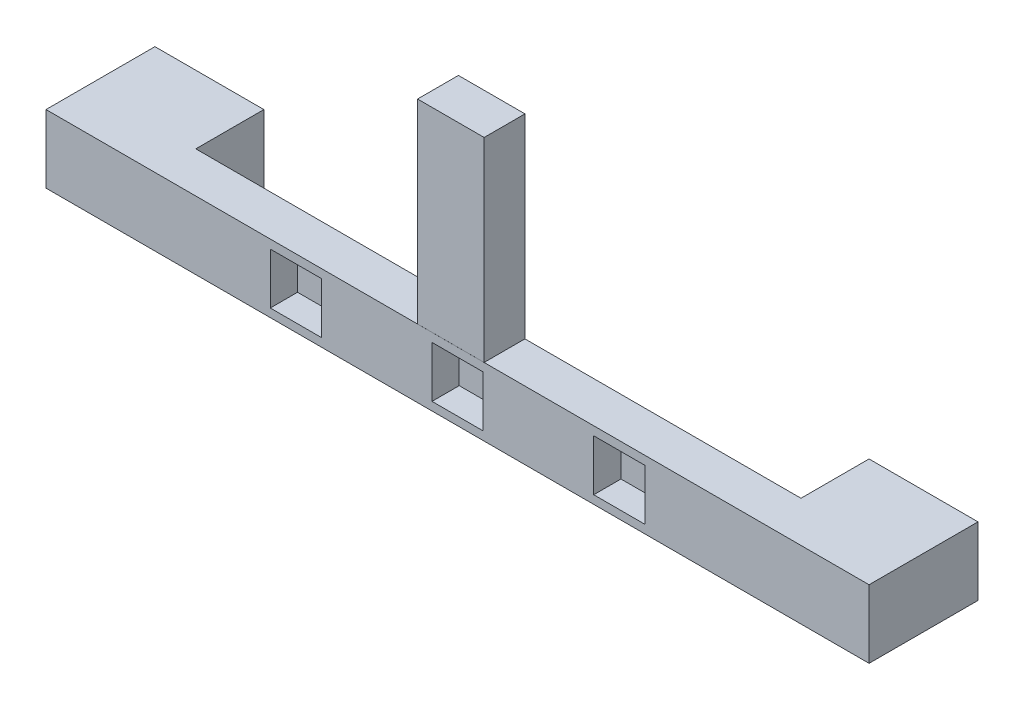
from build123d import *

# Parameters (mm, degrees)
SKETCH1_W           = 89.02999945
SKETCH1_H           = 9.999999777
BOSS_EXTRUDE1_DEPTH = 6
SKETCH3_W           = 7.5
SKETCH3_H           = 7.5
CUT_EXTRUDE1_DEPTH  = 4
SKETCH5_W           = 9.777130559
SKETCH5_H           = 28.616316616
BOSS_EXTRUDE3_DEPTH = 6
SKETCH7_W           = 15.998000227
SKETCH7_H           = 9.999999777
BOSS_EXTRUDE4_DEPTH = 16
SKETCH8_W           = 7.5
SKETCH8_H           = 7.5
CUT_EXTRUDE2_DEPTH  = 4


# Read off the part's stored shape, not the designer's step: Surface-Imported1
with BuildPart() as part:
    # Sketch1 → Boss-Extrude1 (new body)
    with BuildSketch(Plane.XY.offset(9.998000227)):
        with Locations((-23.997000419, 36.104998552)):
            Rectangle(SKETCH1_W, SKETCH1_H)
    extrude(amount=BOSS_EXTRUDE1_DEPTH)

    # Sketch3 → Cut-Extrude1 (cut)
    with BuildSketch(Plane.XY.offset(15.998000227)):
        with Locations((-24.073089458, 36.081492594)):
            Rectangle(SKETCH3_W, SKETCH3_H)
    extrude(amount=-CUT_EXTRUDE1_DEPTH, mode=Mode.SUBTRACT)

    # Sketch7 → Boss-Extrude4 (add)
    with BuildSketch(Plane.ZY.offset(68.512000144)):
        with Locations((7.999000114, 36.104998552)):
            Rectangle(SKETCH7_W, SKETCH7_H)
    boss_extrude4 = extrude(amount=BOSS_EXTRUDE4_DEPTH)

    # Mirror1: Boss-Extrude4 across plane
    add(boss_extrude4.mirror(Plane.ZY.offset(24.073089458)))

    # Sketch8 → Cut-Extrude2 (cut)
    with BuildSketch(Plane.XY.offset(15.998000227)):
        with Locations((-0.323089458, 36.081492594)):
            Rectangle(SKETCH8_W, SKETCH8_H)
    cut_extrude2 = extrude(amount=-CUT_EXTRUDE2_DEPTH, mode=Mode.SUBTRACT)

    # Mirror3: Cut-Extrude2 across plane
    add(cut_extrude2.mirror(Plane.ZY.offset(24.073089458)), mode=Mode.SUBTRACT)


with BuildPart() as body_2:
    # Sketch5 → Boss-Extrude3 (new body)
    with BuildSketch(Plane.XY.offset(9.998000227)):
        with Locations((-25.055517443, 55.419292301)):
            Rectangle(SKETCH5_W, SKETCH5_H)
    extrude(amount=BOSS_EXTRUDE3_DEPTH)


solid = Compound([part.part, body_2.part])
